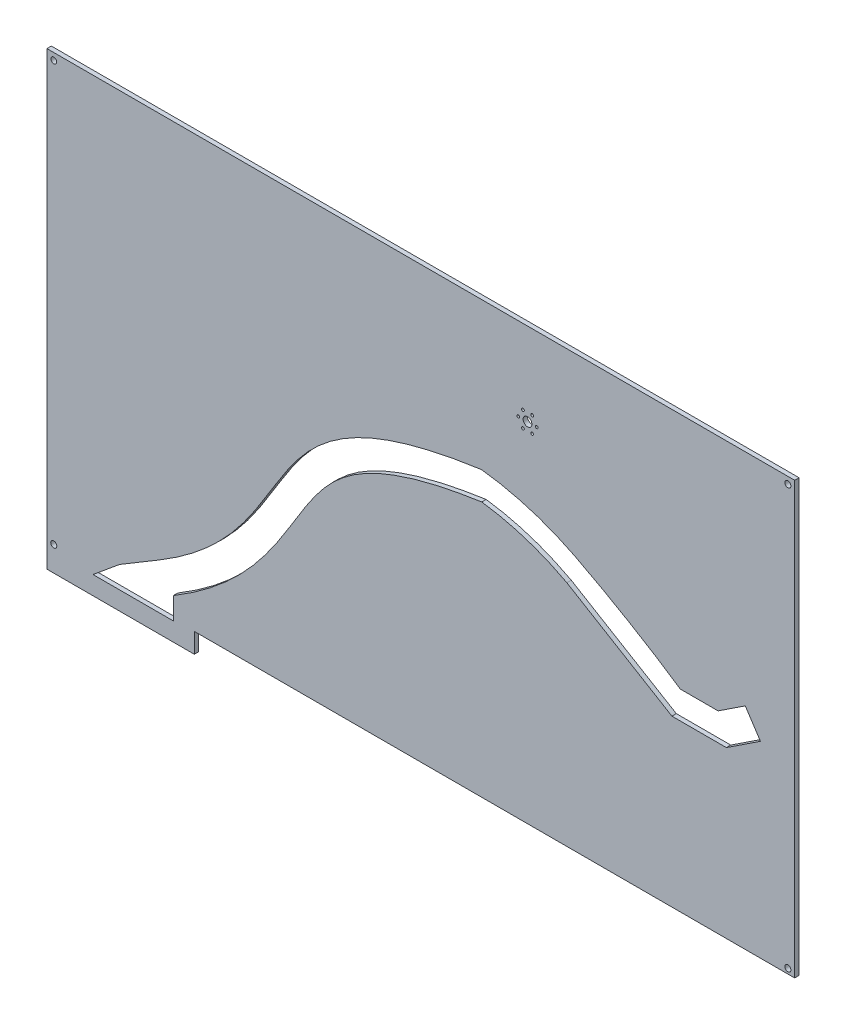
from build123d import *

# Parameters (mm, degrees)
SKETCH1_R           = 3.292374312
SKETCH1_R_2         = 3.294421934
SKETCH1_R_3         = 3.163533699
SKETCH1_R_4         = 1.5
SKETCH1_R_5         = 4.7625
BOSS_EXTRUDE1_DEPTH = 4.7625


with BuildPart() as part:
    # Sketch1 → Boss-Extrude1 (new body)
    with BuildSketch(Plane.XY):
        Polygon((-436.816755826, -147.994392447), (-436.816755826, -169.55039994), (-596.816755826, -169.55039994), (-596.816755826, -150), (-596.816755826, 320), (215.080766979, 320), (215.080766979, -147.994392447), align=None)
        with Locations((-589.375723826, -142.5578)):
            Circle(SKETCH1_R, mode=Mode.SUBTRACT)
        with Locations((207.642212326, -142.5578)):
            Circle(SKETCH1_R, mode=Mode.SUBTRACT)
        with Locations((207.642212326, 312.5578)):
            Circle(SKETCH1_R_2, mode=Mode.SUBTRACT)
        with Locations((-589.375723826, 312.5578)):
            Circle(SKETCH1_R_3, mode=Mode.SUBTRACT)
        with Locations((-85, 230)):
            Circle(SKETCH1_R_4, mode=Mode.SUBTRACT)
        with Locations((-80, 238.660254038)):
            Circle(SKETCH1_R_4, mode=Mode.SUBTRACT)
        with Locations((-70, 238.660254038)):
            Circle(SKETCH1_R_4, mode=Mode.SUBTRACT)
        with Locations((-65, 230)):
            Circle(SKETCH1_R_4, mode=Mode.SUBTRACT)
        with Locations((-70, 221.339745962)):
            Circle(SKETCH1_R_4, mode=Mode.SUBTRACT)
        with Locations((-80, 221.339745962)):
            Circle(SKETCH1_R_4, mode=Mode.SUBTRACT)
        with Locations((-75, 230)):
            Circle(SKETCH1_R_5, mode=Mode.SUBTRACT)
        with BuildLine():
            Line((-475, -100), (-518.031074044, -125.74437106))
            Line((-518.031074044, -125.74437106), (-546.780363752, -149.55039994))
            Line((-546.780363752, -149.55039994), (-459.597813184, -149.55039994))
            Line((-459.597813184, -149.55039994), (-459.597813184, -125.74437106))
            add(Edge.make_bspline(
                [(-459.597813184, -125.74437106), (-458.129207209, -124.865742348), (-455.185829054, -123.081513508), (-449.471359557, -119.524654219), (-442.555549408, -115.046151368), (-434.636214281, -109.639746192), (-424.556425744, -102.386073958), (-412.829398694, -93.24529863), (-400.055778993, -82.1905419), (-388.486450966, -71.092190732), (-374.537420018, -56.304576734), (-359.620141336, -37.979207276), (-344.890774823, -16.767556206), (-332.340078528, 3.245699555), (-321.055163892, 21.796443272), (-310.225956981, 38.664819129), (-299.079604806, 53.834809894), (-286.812791685, 67.514642691), (-272.431751915, 80.088460877), (-257.652665703, 89.924055398), (-243.498210685, 97.442015492), (-231.565093385, 102.886615769), (-218.172694067, 108.112662921), (-203.190999217, 113.087836875), (-189.281720356, 116.996077726), (-177.243425929, 119.962936855), (-167.745823902, 122.104113686), (-157.766000623, 124.157339904), (-149.036898589, 125.791853127), (-141.799270328, 127.051772068), (-136.243143266, 127.972296195), (-131.502167372, 128.719120718), (-127.648712651, 129.303231945), (-125.690331117, 129.592450023), (-124.714693771, 129.734664734)],
                knots=[0, 0, 0, 0, 0.00777259, 0.01554518, 0.03109036, 0.04663554, 0.062180721, 0.093271081, 0.124361441, 0.155451801, 0.186542162, 0.248722882, 0.310903603, 0.373084323, 0.435265044, 0.497445764, 0.559626485, 0.621807206, 0.683987926, 0.746168647, 0.777259007, 0.808349367, 0.839439728, 0.870530088, 0.901620448, 0.917165628, 0.932710808, 0.948255989, 0.963801169, 0.971573759, 0.979346349, 0.987118939, 0.991005234, 0.994891529, 0.994891529, 0.994891529, 0.994891529], degree=3))
            ThreePointArc((-124.714693771, 129.734664734), (-77.172123272, 119.052933104), (-32.323699215, 100))
            Line((-32.323699215, 100), (81.77450832, 31.56416045))
            Line((81.77450832, 31.56416045), (140.88780849, 31.56416045))
            Line((140.88780849, 31.56416045), (177.923308763, 55.973921994))
            Line((177.923308763, 55.973921994), (161.413907899, 81.022668132))
            Line((161.413907899, 81.022668132), (131.890654865, 61.56416045))
            Line((131.890654865, 61.56416045), (90.97120992, 61.56416045))
            ThreePointArc((90.97120992, 61.56416045), (35.57180112, 96.520479224), (-21.701372103, 128.313911667))
            Line((-21.701372103, 128.313911667), (-25, 130))
            ThreePointArc((-25, 130), (-73.684930832, 149.383563894), (-125, 160))
            add(Edge.make_bspline(
                [(-475, -100), (-419.540575809, -66.820070684), (-329.590802121, 43.11603253), (-307.635554762, 134.287094016), (-125, 160)],
                knots=[0, 0, 0, 0, 0.312223899, 1, 1, 1, 1], degree=3))
        make_face(mode=Mode.SUBTRACT)
    extrude(amount=BOSS_EXTRUDE1_DEPTH)


solid = part.part
